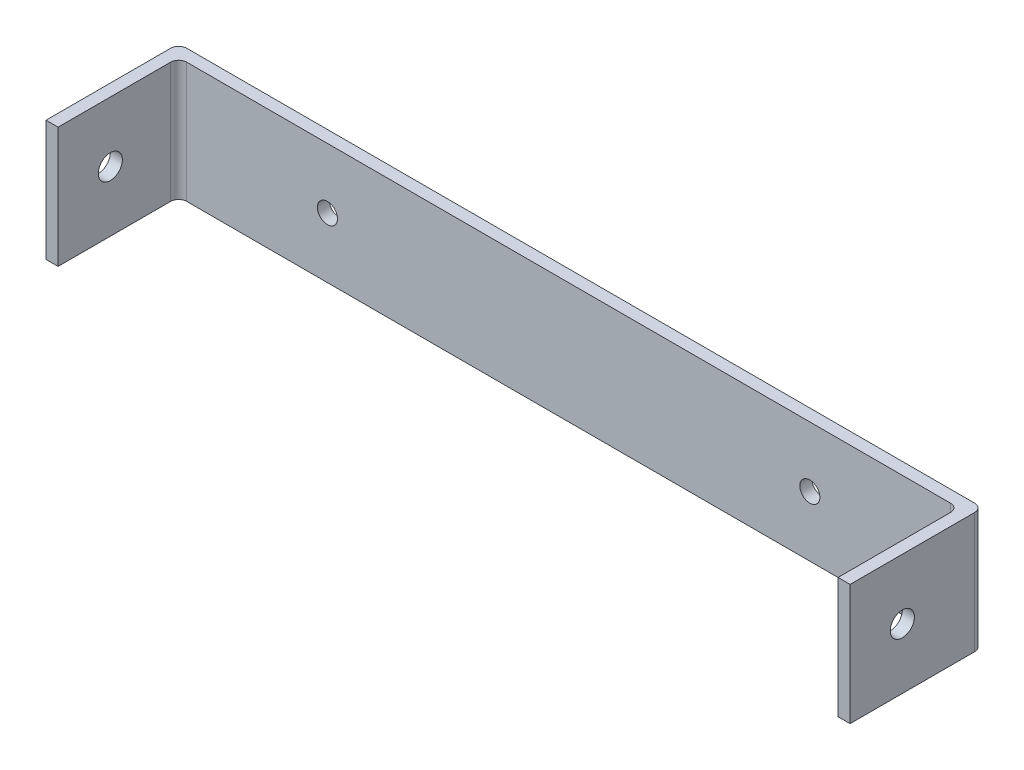
from build123d import *

# Parameters (mm, degrees)
ESQUISSE1_W             = 200
ESQUISSE1_H             = 30
ESQUISSE1_R             = 2.5
BOSS_EXTRU_1_DEPTH      = 3
ESQUISSE2_W             = 3
ESQUISSE2_H             = 30
BOSS_EXTRU_2_DEPTH      = 30
ESQUISSE3_R             = 3
ENL_V_MAT_EXTRU_1_DEPTH = 229
CONG_1_R                = 2


with BuildPart() as part:
    # Esquisse1 → Boss.-Extru.1 (new body)
    with BuildSketch(Plane.XY):
        with Locations((100, -15)):
            Rectangle(ESQUISSE1_W, ESQUISSE1_H)
        with Locations((40, -15)):
            Circle(ESQUISSE1_R, mode=Mode.SUBTRACT)
        with Locations((160, -15)):
            Circle(ESQUISSE1_R, mode=Mode.SUBTRACT)
    extrude(amount=BOSS_EXTRU_1_DEPTH)

    # Esquisse2 → Boss.-Extru.2 (add)
    with BuildSketch(Plane.XY.offset(3)):
        with Locations((1.5, -15)):
            Rectangle(ESQUISSE2_W, ESQUISSE2_H)
        with Locations((198.5, -15)):
            Rectangle(ESQUISSE2_W, ESQUISSE2_H)
    extrude(amount=BOSS_EXTRU_2_DEPTH)

    # Esquisse3 → Enlèv. mat.-Extru.1 (cut)
    with BuildSketch(Plane.ZY):
        with Locations((20, -15)):
            Circle(ESQUISSE3_R)
    extrude(amount=-ENL_V_MAT_EXTRU_1_DEPTH, mode=Mode.SUBTRACT)

    # Congé1
    cong_1_edges = [part.edges().sort_by_distance(p)[0] for p in [
        (200, -15, 0),
        (197, -15, 3),
        (0, -15, 0),
        (3, -15, 3),
    ]]
    fillet(cong_1_edges, radius=CONG_1_R)


solid = part.part
